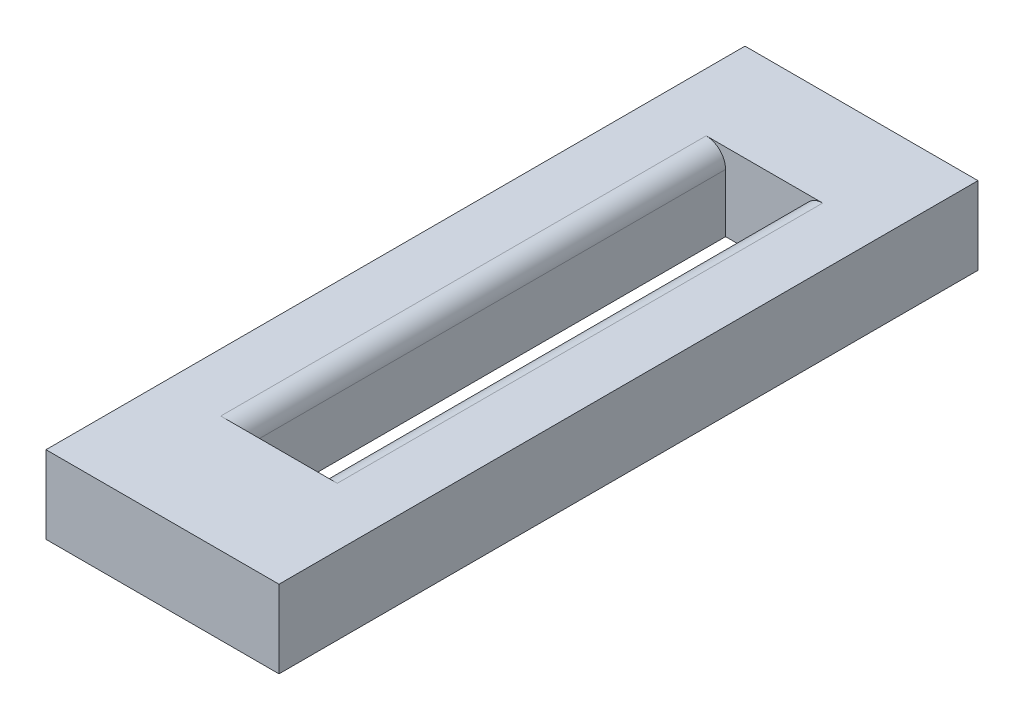
from build123d import *

# Parameters (mm, degrees)
SKETCH_2_W          = 60
SKETCH_2_H          = 20
EXTRUDE_1_DEPTH     = 180
SKETCH_14_W         = 20
SKETCH_14_H         = 125
CUT_EXTRUDE_1_DEPTH = 184.575597507
FILLET_1_R          = 5


with BuildPart() as part:
    # 草圖2 → 填料-伸長1 (new body)
    with BuildSketch(Plane.XY):
        Rectangle(SKETCH_2_W, SKETCH_2_H)
    extrude(amount=-EXTRUDE_1_DEPTH)

    # 草圖14 → 除料-伸長1 (cut, through all)
    with BuildSketch(Plane(origin=(0, 10, 0), x_dir=(1, 0, 0), z_dir=(0, 1, 0))):
        with Locations((0, 92.5)):
            Rectangle(SKETCH_14_W, SKETCH_14_H)
    extrude(amount=-CUT_EXTRUDE_1_DEPTH, mode=Mode.SUBTRACT)

    # 圓角1
    fillet_1_edges = [part.edges().sort_by_distance(p)[0] for p in [
        (-10, 10, -92.5),
        (10, 10, -92.5),
    ]]
    fillet(fillet_1_edges, radius=FILLET_1_R)


solid = part.part
